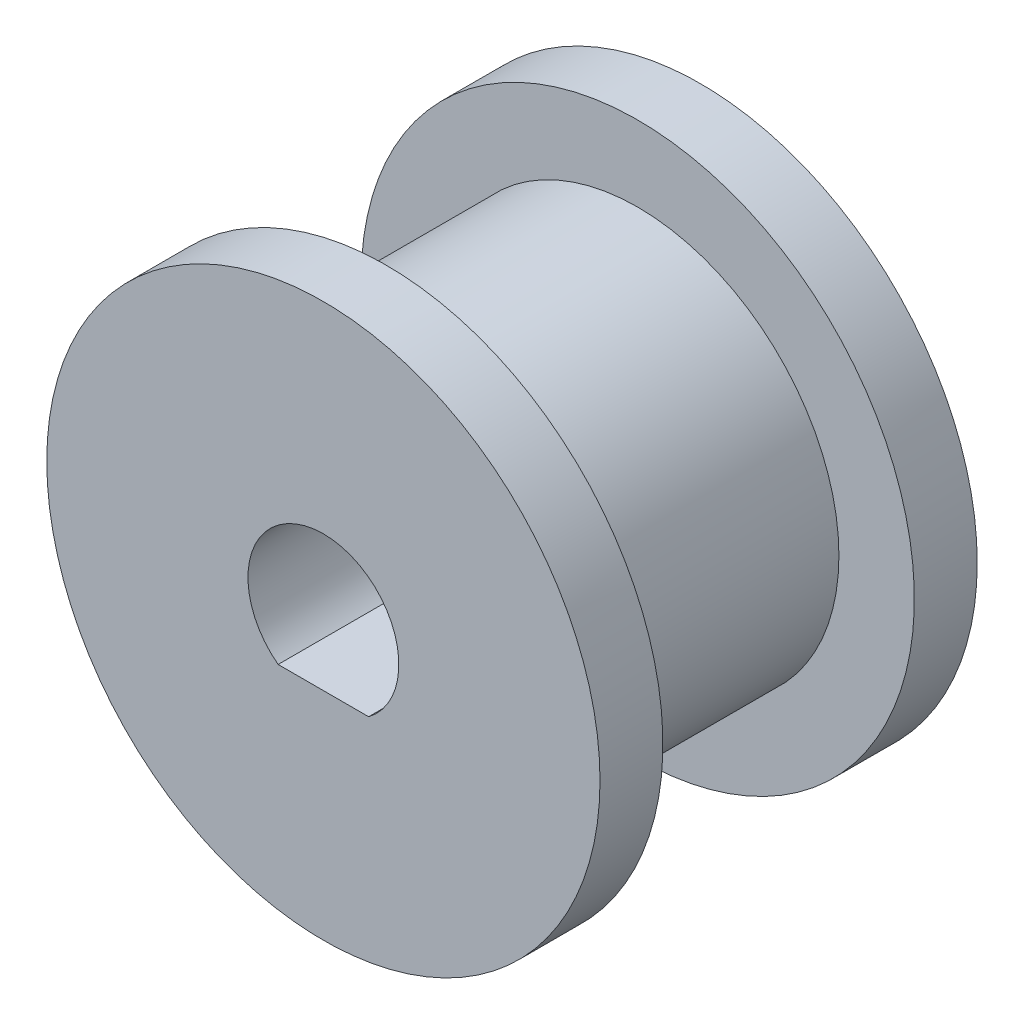
from build123d import *

# Parameters (mm, degrees)
SKETCH1_R           = 11
BOSS_EXTRUDE1_DEPTH = 15
SKETCH2_W           = 3
SKETCH2_H           = 10


with BuildPart() as part:
    # Sketch1 → Boss-Extrude1 (new body)
    with BuildSketch(Plane.XY):
        Circle(SKETCH1_R)
        with BuildLine():
            Line((1.8, -2.4), (-1.8, -2.4))
            ThreePointArc((-1.8, -2.4), (0, 3), (1.8, -2.4))
        make_face(mode=Mode.SUBTRACT)
    extrude(amount=BOSS_EXTRUDE1_DEPTH)

    # Sketch2 → Cut-Revolve1 (revolve, cut)
    with BuildSketch(Plane(origin=(0, 0, 0), x_dir=(1, 0, 0), z_dir=(0, 1, 0))):
        with Locations((-9.5, -7.5)):
            Rectangle(SKETCH2_W, SKETCH2_H)
    revolve(axis=Axis((0, 0, 0), (0, 0, 1)), mode=Mode.SUBTRACT)


solid = part.part
